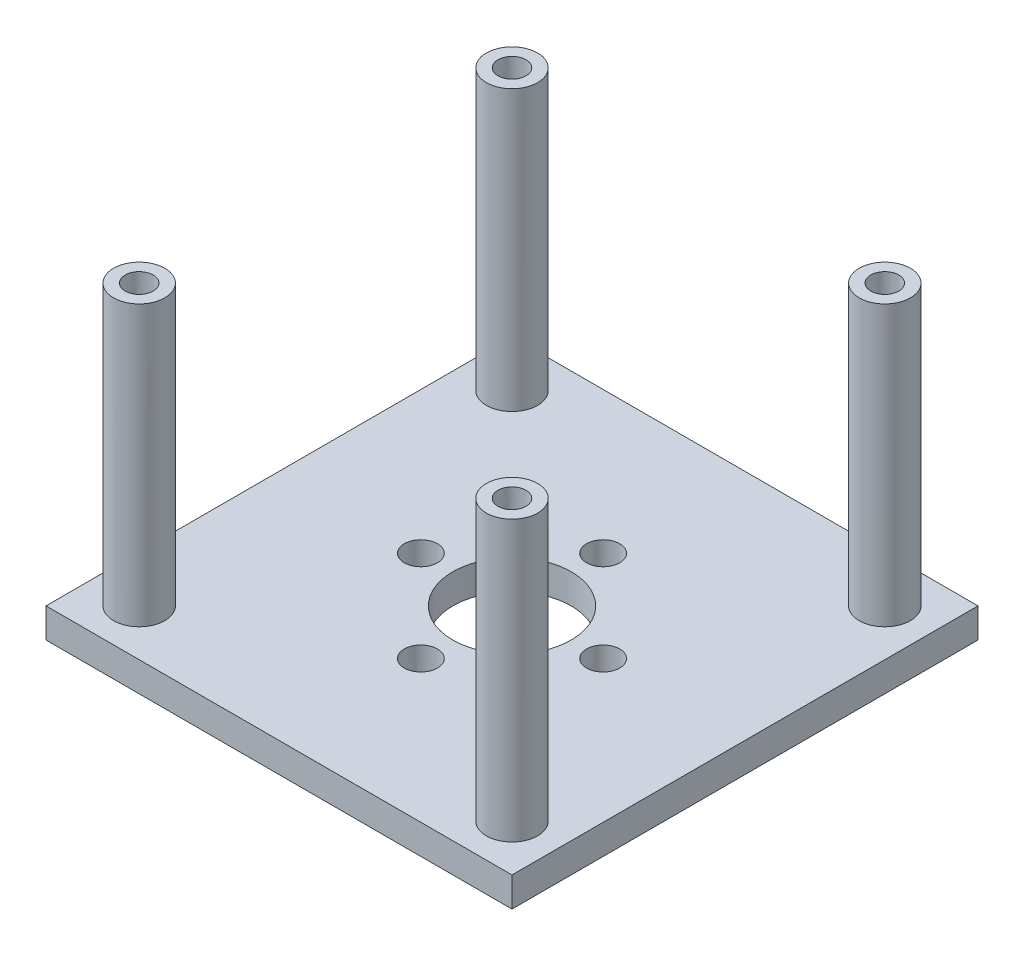
from build123d import *

# Parameters (mm, degrees)
SKETCH1_W           = 50
SKETCH1_H           = 50
SKETCH1_R           = 6.35
SKETCH1_R_2         = 1.778
BOSS_EXTRUDE1_DEPTH = 3.175
SKETCH2_R           = 2.75
SKETCH2_R_2         = 1.5
BOSS_EXTRUDE2_DEPTH = 30


with BuildPart() as part:
    # Sketch1 → Boss-Extrude1 (new body)
    with BuildSketch(Plane(origin=(0, 0, 0), x_dir=(1, 0, 0), z_dir=(0, 1, 0))):
        Rectangle(SKETCH1_W, SKETCH1_H)
        Circle(SKETCH1_R, mode=Mode.SUBTRACT)
        with Locations((-9.779, 0)):
            Circle(SKETCH1_R_2, mode=Mode.SUBTRACT)
        with Locations((9.779, 0)):
            Circle(SKETCH1_R_2, mode=Mode.SUBTRACT)
        with Locations((0, 9.779)):
            Circle(SKETCH1_R_2, mode=Mode.SUBTRACT)
        with Locations((0, -9.779)):
            Circle(SKETCH1_R_2, mode=Mode.SUBTRACT)
    extrude(amount=BOSS_EXTRUDE1_DEPTH)

    # Sketch2 → Boss-Extrude2 (add)
    # profile 1 of 4: a face of its own
    with BuildSketch(Plane(origin=(0, 3.175, 0), x_dir=(1, 0, 0), z_dir=(0, 1, 0))):
        with Locations((20, -20)):
            Circle(SKETCH2_R)
        with Locations((20, -20)):
            Circle(SKETCH2_R_2, mode=Mode.SUBTRACT)
    # profile 2 of 4: a face of its own
    with BuildSketch(Plane(origin=(0, 3.175, 0), x_dir=(1, 0, 0), z_dir=(0, 1, 0))):
        with Locations((-20, -20)):
            Circle(SKETCH2_R)
        with Locations((-20, -20)):
            Circle(SKETCH2_R_2, mode=Mode.SUBTRACT)
    # profile 3 of 4: a face of its own
    with BuildSketch(Plane(origin=(0, 3.175, 0), x_dir=(1, 0, 0), z_dir=(0, 1, 0))):
        with Locations((-20, 20)):
            Circle(SKETCH2_R)
        with Locations((-20, 20)):
            Circle(SKETCH2_R_2, mode=Mode.SUBTRACT)
    # profile 4 of 4: a face of its own
    with BuildSketch(Plane(origin=(0, 3.175, 0), x_dir=(1, 0, 0), z_dir=(0, 1, 0))):
        with Locations((20, 20)):
            Circle(SKETCH2_R)
        with Locations((20, 20)):
            Circle(SKETCH2_R_2, mode=Mode.SUBTRACT)
    extrude(amount=BOSS_EXTRUDE2_DEPTH)


solid = part.part
